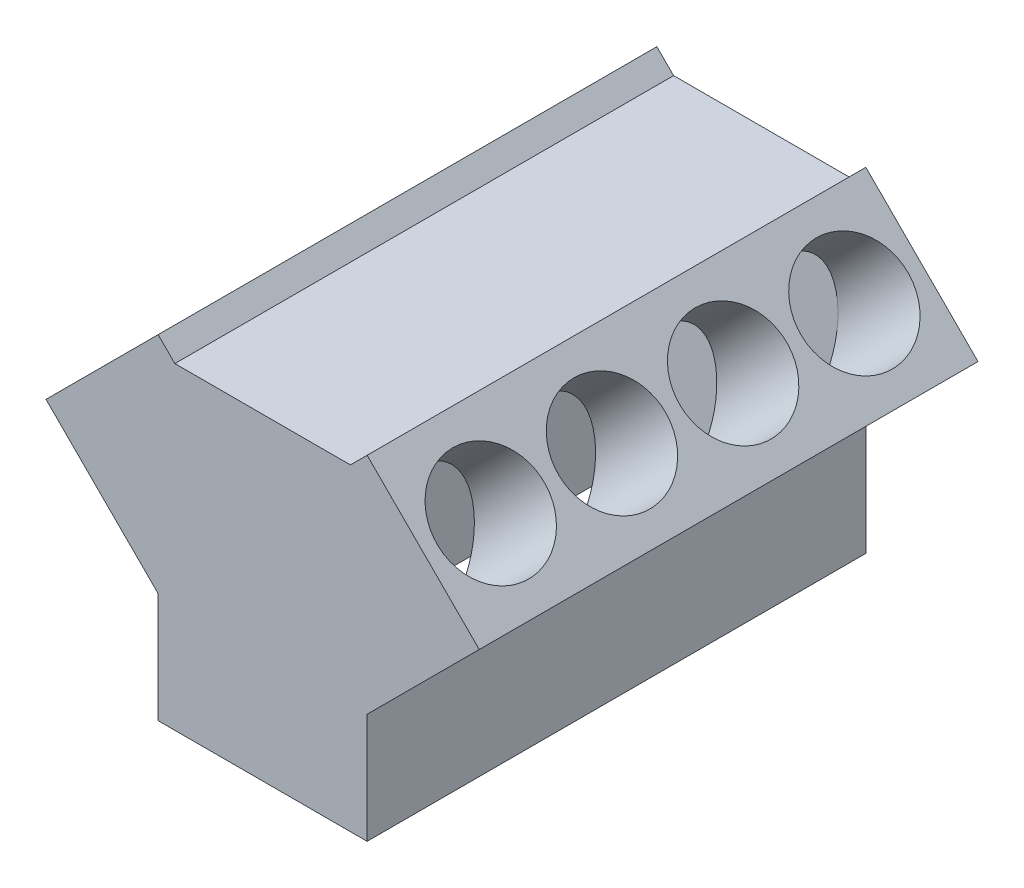
from build123d import *

# Parameters (mm, degrees)
SKETCH1_W           = 100
SKETCH1_H           = 358
BOSS_EXTRUDE1_DEPTH = 90
CHAMFER1_START      = -100
CHAMFER1_OUTLINE_W  = 113
CHAMFER1_OUTLINE_H  = 358
CHAMFER1_DEPTH      = 56.159379566
SKETCH3_W           = 358
SKETCH3_H           = 90
BOSS_EXTRUDE2_DEPTH = 53
SKETCH4_W           = 150
SKETCH4_H           = 358
BOSS_EXTRUDE3_DEPTH = 150
SKETCH5_W           = 78
SKETCH5_H           = 358
CUT_EXTRUDE2_DEPTH  = 12
CHAMFER3_SIZE       = 83
SKETCH6_W           = 124
SKETCH6_H           = 358
CUT_EXTRUDE3_DEPTH  = 12
CHAMFER4_SIZE       = 13
SKETCH7_R           = 38.5
CUT_EXTRUDE4_DEPTH  = 115
SKETCH8_R           = 38.5
CUT_EXTRUDE5_DEPTH  = 115
SKETCH9_W           = 130
SKETCH9_H           = 338
CUT_EXTRUDE6_DEPTH  = 210


with BuildPart() as part:
    # Sketch1 → Boss-Extrude1 (new body)
    with BuildSketch(Plane(origin=(0, 0, 0), x_dir=(1, 0, 0), z_dir=(0, 1, 0))):
        Rectangle(SKETCH1_W, SKETCH1_H)
    extrude(amount=BOSS_EXTRUDE1_DEPTH)

    # Chamfer1: read off the stored shape, not the designer's step
    # Chamfer1 outline → Chamfer1 (cut)
    with BuildSketch(Plane(origin=(0, 0, 0), x_dir=(0.7071067811865474, 0.7071067811865477, 0), z_dir=(0.7071067811865476, -0.7071067811865476, 0)).offset(CHAMFER1_START)):
        with Locations((28.5, 0)):
            Rectangle(CHAMFER1_OUTLINE_W, CHAMFER1_OUTLINE_H)
    extrude(amount=CHAMFER1_DEPTH, mode=Mode.SUBTRACT)

    # Sketch3 → Boss-Extrude2 (add)
    with BuildSketch(Plane(origin=(50, 0, 0), x_dir=(0, 0, -1), z_dir=(1, 0, 0))):
        with Locations((0, 45)):
            Rectangle(SKETCH3_W, SKETCH3_H)
    extrude(amount=BOSS_EXTRUDE2_DEPTH)

    # Mirror2: part across plane


with BuildPart() as part_1:
    add(part.part)
    add(part.part.mirror(Plane(origin=(103, 0, 0), x_dir=(0, 0, 1), z_dir=(1, 0, 0))))

    # Sketch4 → Boss-Extrude3 (add)
    with BuildSketch(Plane.XZ):
        with Locations((103, 0)):
            Rectangle(SKETCH4_W, SKETCH4_H)
    extrude(amount=BOSS_EXTRUDE3_DEPTH)

    # Sketch5 → Cut-Extrude2 (cut)
    with BuildSketch(Plane.XZ):
        with Locations((-11, 0)):
            Rectangle(SKETCH5_W, SKETCH5_H)
        with Locations((217, 0)):
            Rectangle(SKETCH5_W, SKETCH5_H)
    extrude(amount=-CUT_EXTRUDE2_DEPTH, mode=Mode.SUBTRACT)

    # Chamfer3
    # the kernel refuses this chamfer: 83 mm, written as the material it adds along each edge
    with BuildSketch(Plane(origin=(178, 12, 179), x_dir=(0, -1, 0), z_dir=(0, 0, -1))) as chamfer3_piece_1_section:
        Polygon((CHAMFER3_SIZE, 0), (0, -CHAMFER3_SIZE), (0, 0), align=None)
    chamfer3_piece_1 = extrude(amount=358, mode=Mode.PRIVATE)
    chamfer3_piece_1 = split(chamfer3_piece_1, bisect_by=Plane(origin=(217, 51, 179), z_dir=(-0.7071067811865476, -0.7071067811865476, 0)), keep=Keep.TOP, mode=Mode.PRIVATE)
    add(chamfer3_piece_1)
    with BuildSketch(Plane(origin=(28, 12, 179), x_dir=(-1, 0, 0), z_dir=(0, 0, -1))) as chamfer3_piece_2_section:
        Polygon((CHAMFER3_SIZE, 0), (0, -CHAMFER3_SIZE), (0, 0), align=None)
    chamfer3_piece_2 = extrude(amount=358, mode=Mode.PRIVATE)
    chamfer3_piece_2 = split(chamfer3_piece_2, bisect_by=Plane(origin=(-11, 51, 179), z_dir=(0.7071067811865476, -0.7071067811865476, 0)), keep=Keep.TOP, mode=Mode.PRIVATE)
    add(chamfer3_piece_2)

    # Sketch6 → Cut-Extrude3 (cut)
    with BuildSketch(Plane(origin=(0, 90, 0), x_dir=(1, 0, 0), z_dir=(0, 1, 0))):
        with Locations((103, 0)):
            Rectangle(SKETCH6_W, SKETCH6_H)
    extrude(amount=-CUT_EXTRUDE3_DEPTH, mode=Mode.SUBTRACT)

    # Chamfer4
    # the kernel refuses this chamfer: 13 mm, written as the material it takes off along each edge
    with BuildSketch(Plane(origin=(165, 90, 212.431878844), x_dir=(0, -1, 0), z_dir=(0, 0, -1))) as chamfer4_piece_1_section:
        Polygon((CHAMFER4_SIZE, 0), (0, -CHAMFER4_SIZE), (0, 0), align=None)
    chamfer4_piece_1 = extrude(amount=424.863757687, mode=Mode.PRIVATE)
    chamfer4_piece_1 = split(chamfer4_piece_1, bisect_by=Plane(origin=(165, 78, 212.431878844), z_dir=(0, 1, 0)), keep=Keep.TOP, mode=Mode.PRIVATE)
    add(chamfer4_piece_1, mode=Mode.SUBTRACT)
    with BuildSketch(Plane(origin=(41, 90, -212.431878844), x_dir=(-1, 0, 0), z_dir=(0, 0, 1))) as chamfer4_piece_2_section:
        Polygon((CHAMFER4_SIZE, 0), (0, CHAMFER4_SIZE), (0, 0), align=None)
    chamfer4_piece_2 = extrude(amount=424.863757687, mode=Mode.PRIVATE)
    chamfer4_piece_2 = split(chamfer4_piece_2, bisect_by=Plane(origin=(41, 78, -212.431878844), z_dir=(0, 1, 0)), keep=Keep.TOP, mode=Mode.PRIVATE)
    add(chamfer4_piece_2, mode=Mode.SUBTRACT)

    # Sketch7 → Cut-Extrude4 (cut)
    with BuildSketch(Plane(origin=(-31, 31, 0), x_dir=(0, 0, 1), z_dir=(-0.7071067811865477, 0.7071067811865475, 0))):
        with Locations(Location((130.362769157, 26.516504294, 0), (0, 0, 270))):
            Circle(SKETCH7_R)
        with Locations(Location((43.362769157, 26.516504294, 0), (0, 0, 270))):
            Circle(SKETCH7_R)
        with Locations(Location((-43.637230843, 26.516504294, 0), (0, 0, 270))):
            Circle(SKETCH7_R)
        with Locations(Location((-130.637230843, 26.516504294, 0), (0, 0, 270))):
            Circle(SKETCH7_R)
    extrude(amount=-CUT_EXTRUDE4_DEPTH, mode=Mode.SUBTRACT)

    # Sketch8 → Cut-Extrude5 (cut)
    with BuildSketch(Plane(origin=(134, 134, 0), x_dir=(0, 0, -1), z_dir=(0.7071067811865477, 0.7071067811865475, 0))):
        with Locations(Location((-130.5, -119.14749263, 0), (0, 0, 90))):
            Circle(SKETCH8_R)
        with Locations(Location((-43.5, -119.14749263, 0), (0, 0, 90))):
            Circle(SKETCH8_R)
        with Locations(Location((43.5, -119.14749263, 0), (0, 0, 90))):
            Circle(SKETCH8_R)
        with Locations(Location((130.5, -119.14749263, 0), (0, 0, 90))):
            Circle(SKETCH8_R)
    extrude(amount=-CUT_EXTRUDE5_DEPTH, mode=Mode.SUBTRACT)

    # Sketch9 → Cut-Extrude6 (cut)
    with BuildSketch(Plane.XZ.offset(150)):
        with Locations((103, 0)):
            Rectangle(SKETCH9_W, SKETCH9_H)
    extrude(amount=-CUT_EXTRUDE6_DEPTH, mode=Mode.SUBTRACT)


solid = part_1.part
